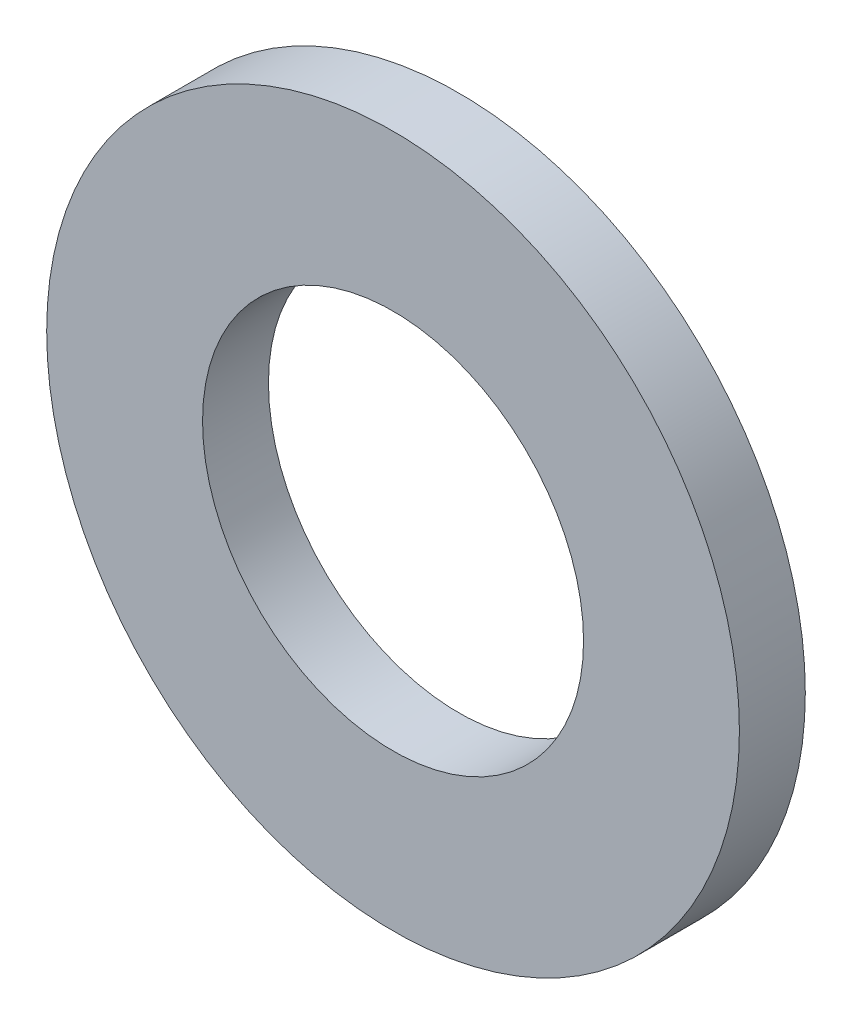
from build123d import *

# Parameters (mm, degrees)
SKETCH1_R           = 9.525
SKETCH1_R_2         = 5.23875
BOSS_EXTRUDE1_DEPTH = 0.906250029


with BuildPart() as part:
    # Sketch1 → Boss-Extrude1 (new, symmetric)
    with BuildSketch(Plane.XY):
        Circle(SKETCH1_R)
        Circle(SKETCH1_R_2, mode=Mode.SUBTRACT)
    extrude(amount=BOSS_EXTRUDE1_DEPTH, both=True)


solid = part.part
